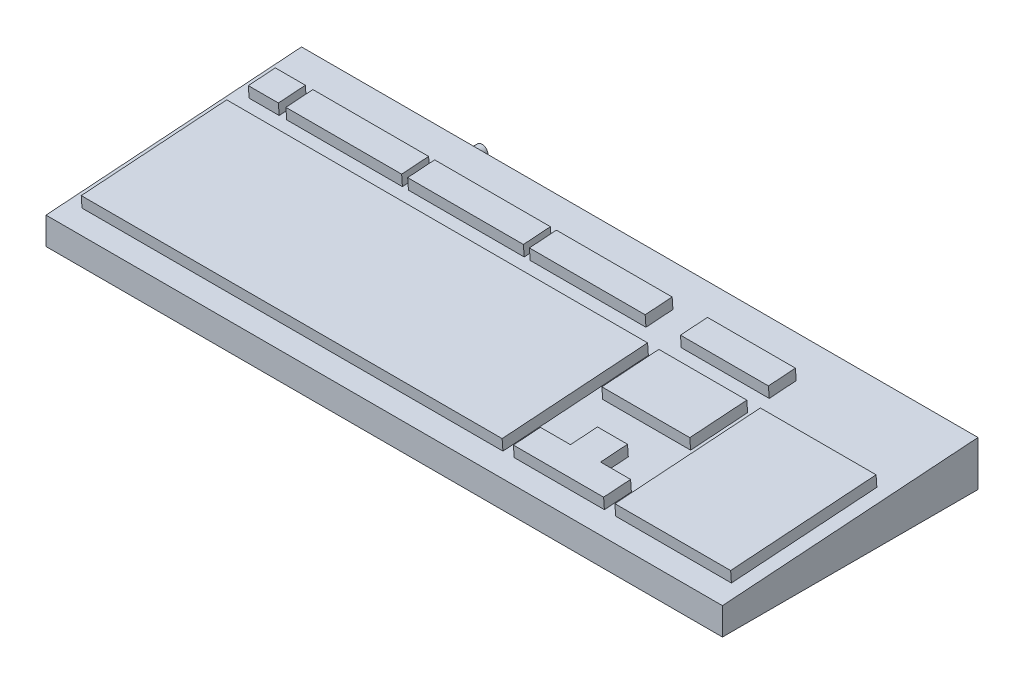
from build123d import *

# Parameters (mm, degrees)
SKETCH1_W           = 450
SKETCH1_H           = 170
BOSS_EXTRUDE1_DEPTH = 30
CHAMFER1_SIZE       = 11.88755803
CHAMFER1_SIZE_2     = 170
SKETCH2_R           = 4
BOSS_EXTRUDE2_DEPTH = 15
SKETCH3_W           = 280
SKETCH3_H           = 97
SKETCH3_W_2         = 20
SKETCH3_H_2         = 18
SKETCH3_W_3         = 77
SKETCH3_W_4         = 58.5
SKETCH3_H_3         = 38
BOSS_EXTRUDE3_DEPTH = 7.5


with BuildPart() as part:
    # Sketch1 → Boss-Extrude1 (new body)
    with BuildSketch(Plane(origin=(0, 0, 0), x_dir=(1, 0, 0), z_dir=(0, 1, 0))):
        with Locations((225, 85)):
            Rectangle(SKETCH1_W, SKETCH1_H)
    extrude(amount=BOSS_EXTRUDE1_DEPTH)

    # Chamfer1
    # the kernel refuses this chamfer: 170, 11.88755803 mm, written as the material it takes off along each edge
    with BuildSketch(Plane(origin=(-441.960179797, 30, 0), x_dir=(0, -0.8766829747338916, 0.48106856248536445), z_dir=(1, 0, 0))) as chamfer1_piece_1:
        Polygon((CHAMFER1_SIZE * 0.876682974763, CHAMFER1_SIZE * 0.481068562501), (-CHAMFER1_SIZE_2 * 0.481068562485, CHAMFER1_SIZE_2 * 0.876682974734), (0, 0), align=None)
    extrude(amount=1333.920359594, mode=Mode.SUBTRACT)

    # Sketch2 → Boss-Extrude2 (add)
    with BuildSketch(Plane(origin=(0, 0, -170), x_dir=(-1, 0, 0), z_dir=(0, 0, -1))):
        with Locations(Location((-105, 15, 0), (0, 0, 180))):
            Circle(SKETCH2_R)
    extrude(amount=BOSS_EXTRUDE2_DEPTH)

    # Sketch3 → Boss-Extrude3 (add)
    with BuildSketch(Plane(origin=(0, 18.02430745, 1.260382357), x_dir=(1, 0, 0), z_dir=(0, 0.9975640502598245, 0.06975647374412289))):
        Polygon((296.5, 16.263460083), (356.5, 16.263460083), (356.5, 34.263460083), (336.5, 34.263460083), (336.5, 52.263460083), (316.5, 52.263460083), (316.5, 34.263460083), (296.5, 34.263460083), align=None)
        with Locations((149, 64.763460083)):
            Rectangle(SKETCH3_W, SKETCH3_H)
        with Locations((19, 136.678582756)):
            Rectangle(SKETCH3_W_2, SKETCH3_H_2)
        with Locations((72.5, 136.678582756)):
            Rectangle(SKETCH3_W_3, SKETCH3_H_2)
        with Locations((153.5, 136.678582756)):
            Rectangle(SKETCH3_W_3, SKETCH3_H_2)
        with Locations((234.5, 136.678582756)):
            Rectangle(SKETCH3_W_3, SKETCH3_H_2)
        with Locations((325.75, 136.678582756)):
            Rectangle(SKETCH3_W_4, SKETCH3_H_2)
        with Locations((325.75, 94.263460083)):
            Rectangle(SKETCH3_W_4, SKETCH3_H_3)
        with Locations((402.5, 64.763460083)):
            Rectangle(SKETCH3_W_3, SKETCH3_H)
    extrude(amount=BOSS_EXTRUDE3_DEPTH)


solid = part.part
